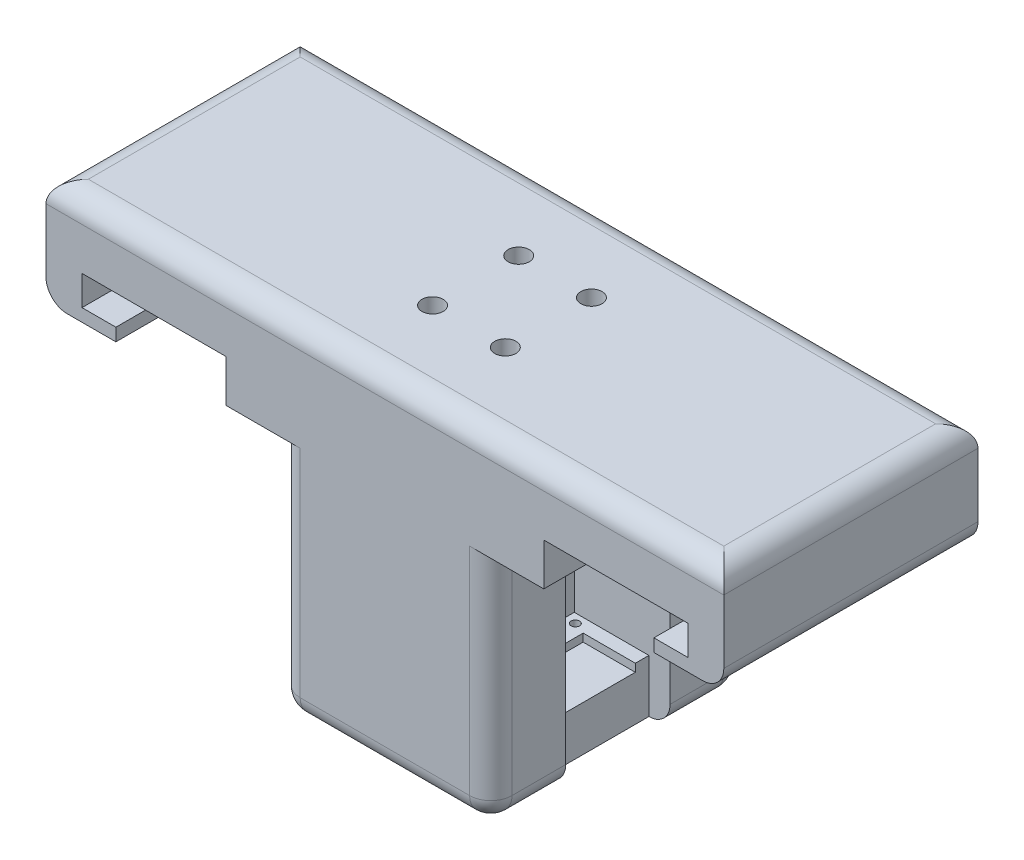
from build123d import *

# Parameters (mm, degrees)
BOSS_EXTRUDE1_DEPTH            = 30
BOSS_EXTRUDE1_DEPTH_BACK       = 30
CUT_REVOLVE2_START             = 59
CUT_REVOLVE2_DEPTH             = 7
CUT_REVOLVE2_START_2           = 56
CUT_REVOLVE2_2_DEPTH           = 3
CUT_EXTRUDE1_DEPTH             = 22.615
CUT_EXTRUDE2_REACH             = 130.69
CUT_EXTRUDE2_DIRECTION_2_DEPTH = 129.689548915
FILLET5_R                      = 5
FILLET6_R                      = 5
SKETCH7_W                      = 18.23
SKETCH7_H                      = 1.85
CUT_EXTRUDE3_DEPTH             = 17.32
SKETCH8_W                      = 20
SKETCH8_H                      = 24.63
CUT_EXTRUDE4_DEPTH             = 15.3
CUT_EXTRUDE5_REACH             = 119.733
SKETCH10_R                     = 1
SKETCH12_R                     = 2.5
CUT_EXTRUDE6_DEPTH             = 10.5
CUT_EXTRUDE7_REACH             = 119.733
SKETCH13_R                     = 1
SKETCH14_R                     = 2.5
CUT_EXTRUDE8_DEPTH             = 34.5


# Read off the part's stored shape, not the designer's step: Cut-Revolve2
with BuildPart() as part:
    # Sketch1 → Boss-Extrude1 (new, two sides: drawn at the far end of the back side and taken through both)
    with BuildSketch(Plane.XY.offset(-BOSS_EXTRUDE1_DEPTH_BACK)):
        Polygon((-25, 0), (-25, 56), (-80, 56), (-80, 81), (80, 81), (80, 56), (25, 56), (25, 0), align=None)
    extrude(amount=BOSS_EXTRUDE1_DEPTH + BOSS_EXTRUDE1_DEPTH_BACK)

    # Cut-Revolve2 outline → Cut-Revolve2 (cut)
    with BuildSketch(Plane(origin=(0, 0, 0), x_dir=(1, 0, 0), z_dir=(0, 1, 0)).offset(CUT_REVOLVE2_START)):
        with BuildLine():
            ThreePointArc((-37.5, -6), (-43.043277195, -2.296100594), (-41.742640687, 4.242640687))
            Line((-41.742640687, 4.242640687), (-61.54163056, 24.04163056))
            ThreePointArc((-61.54163056, 24.04163056), (-71.129711609, -5.004247907), (-53.5, -30))
            Line((-53.5, -30), (-37.5, -30))
            Line((-37.5, -30), (-37.5, -6))
        make_face()
    cut_revolve2 = extrude(amount=CUT_REVOLVE2_DEPTH, mode=Mode.SUBTRACT)

    # Cut-Revolve2 2 outline → Cut-Revolve2 2 (cut)
    with BuildSketch(Plane(origin=(0, 0, 0), x_dir=(1, 0, 0), z_dir=(0, 1, 0)).offset(CUT_REVOLVE2_START_2)):
        with BuildLine():
            Line((-37.5, -26), (-37.5, -14))
            ThreePointArc((-37.5, -14), (-50.434313455, -5.357568053), (-47.399494937, 9.899494937))
            Line((-47.399494937, 9.899494937), (-55.884776311, 18.384776311))
            ThreePointArc((-55.884776311, 18.384776311), (-61.520867845, -9.949769241), (-37.5, -26))
        make_face()
    cut_revolve2_2 = extrude(amount=CUT_REVOLVE2_2_DEPTH, mode=Mode.SUBTRACT)

    # Sketch4 → Cut-Extrude1 (cut)
    with BuildSketch(Plane.ZY.offset(25)):
        Polygon((12.315, 12.5), (-12.315, 12.5), (-12.315, 44.5), (-6.965, 44.5), (-6.965, 45.65), (7.015, 45.65), (7.015, 44.5), (12.315, 44.5), align=None)
    cut_extrude1 = extrude(amount=-CUT_EXTRUDE1_DEPTH, mode=Mode.SUBTRACT)

    # Mirror1: Cut-Extrude1 across plane
    add(cut_extrude1.mirror(Plane.ZY), mode=Mode.SUBTRACT)

    # Sketch5 → Cut-Extrude2 (cut, up to next)
    with BuildSketch(Plane.XY.offset(30), mode=Mode.PRIVATE) as cut_extrude2_sk1:
        Polygon((-63.5, 56), (-37.5, 56), (-37.5, 66), (-71.5, 66), (-71.5, 59), (-63.5, 59), align=None)
    cut_extrude2_tool1 = extrude(cut_extrude2_sk1.sketch, amount=-CUT_EXTRUDE2_REACH, mode=Mode.PRIVATE) & part.part
    cut_extrude2 = cut_extrude2_tool1.solids().sort_by_distance((-53.512658, 61.265823, 30))[0]
    add(cut_extrude2, mode=Mode.SUBTRACT)

    # Sketch5 → Cut-Extrude2 direction 2 (cut)
    with BuildSketch(Plane.XY.offset(30)):
        Polygon((-63.5, 56), (-37.5, 56), (-37.5, 66), (-71.5, 66), (-71.5, 59), (-63.5, 59), align=None)
    cut_extrude2_direction_2 = extrude(amount=CUT_EXTRUDE2_DIRECTION_2_DEPTH, mode=Mode.SUBTRACT)

    # Mirror4: Cut-Revolve2, Cut-Revolve2 2 across plane
    add(cut_revolve2.mirror(Plane.ZY), mode=Mode.SUBTRACT)
    add(cut_revolve2_2.mirror(Plane.ZY), mode=Mode.SUBTRACT)

    # Mirror2: Cut-Extrude2, Cut-Extrude2 direction 2 across plane
    add(cut_extrude2.mirror(Plane.ZY), mode=Mode.SUBTRACT)
    add(cut_extrude2_direction_2.mirror(Plane.ZY), mode=Mode.SUBTRACT)

    # Fillet5
    fillet5_edges = [part.edges().sort_by_distance(p)[0] for p in [
        (-80, 81, 0),
        (80, 81, 0),
        (0, 81, -30),
        (0, 81, 30),
    ]]
    fillet(fillet5_edges, radius=FILLET5_R)

    # Fillet6
    fillet6_edges = [part.edges().sort_by_distance(p)[0] for p in [
        (-25, 0, 0),
        (-80, 56, 0),
        (80, 56, 0),
        (25, 0, 0),
        (0, 0, 30),
        (25, 28, 30),
        (-25, 28, 30),
        (-25, 28, -30),
        (0, 0, -30),
        (25, 28, -30),
    ]]
    fillet(fillet6_edges, radius=FILLET6_R)

    # Sketch7 → Cut-Extrude3 (cut)
    with BuildSketch(Plane.ZY.offset(25)):
        with Locations((0, 11.575)):
            Rectangle(SKETCH7_W, SKETCH7_H)
    cut_extrude3 = extrude(amount=-CUT_EXTRUDE3_DEPTH, mode=Mode.SUBTRACT)

    # Mirror5: Cut-Extrude3 across plane
    add(cut_extrude3.mirror(Plane.ZY), mode=Mode.SUBTRACT)

    # Sketch8 → Cut-Extrude4 (cut)
    with BuildSketch(Plane.XZ):
        with Locations((-30, 0)):
            Rectangle(SKETCH8_W, SKETCH8_H)
        with Locations((30, 0)):
            Rectangle(SKETCH8_W, SKETCH8_H)
    extrude(amount=-CUT_EXTRUDE4_DEPTH, mode=Mode.SUBTRACT)

    # Sketch10 → Cut-Extrude5 (cut, up to next)
    with BuildSketch(Plane(origin=(0, 0, 0), x_dir=(-1, 0, 0), z_dir=(0, -1, 0)), mode=Mode.PRIVATE) as cut_extrude5_sk1:
        with Locations(Location((4.785, -10.165, 0), (0, 0, 90))):
            Circle(SKETCH10_R)
    cut_extrude5_tool1 = extrude(cut_extrude5_sk1.sketch, amount=-CUT_EXTRUDE5_REACH, mode=Mode.PRIVATE) & part.part
    # Sketch10 → Cut-Extrude5 (cut, up to next)
    with BuildSketch(Plane(origin=(0, 0, 0), x_dir=(-1, 0, 0), z_dir=(0, -1, 0)), mode=Mode.PRIVATE) as cut_extrude5_sk2:
        with Locations(Location((4.785, 10.165, 0), (0, 0, 180))):
            Circle(SKETCH10_R)
    cut_extrude5_tool2 = extrude(cut_extrude5_sk2.sketch, amount=-CUT_EXTRUDE5_REACH, mode=Mode.PRIVATE) & part.part
    # Sketch10 → Cut-Extrude5 (cut, up to next)
    with BuildSketch(Plane(origin=(0, 0, 0), x_dir=(-1, 0, 0), z_dir=(0, -1, 0)), mode=Mode.PRIVATE) as cut_extrude5_sk3:
        with Locations(Location((-4.785, 10.165, 0), (0, 0, 90))):
            Circle(SKETCH10_R)
    cut_extrude5_tool3 = extrude(cut_extrude5_sk3.sketch, amount=-CUT_EXTRUDE5_REACH, mode=Mode.PRIVATE) & part.part
    # Sketch10 → Cut-Extrude5 (cut, up to next)
    with BuildSketch(Plane(origin=(0, 0, 0), x_dir=(-1, 0, 0), z_dir=(0, -1, 0)), mode=Mode.PRIVATE) as cut_extrude5_sk4:
        with Locations((-4.785, -10.165)):
            Circle(SKETCH10_R)
    cut_extrude5_tool4 = extrude(cut_extrude5_sk4.sketch, amount=-CUT_EXTRUDE5_REACH, mode=Mode.PRIVATE) & part.part
    add(cut_extrude5_tool1.solids().sort_by_distance((-4.785, 0, 10.165))[0], mode=Mode.SUBTRACT)
    add(cut_extrude5_tool2.solids().sort_by_distance((-4.785, 0, -10.165))[0], mode=Mode.SUBTRACT)
    add(cut_extrude5_tool3.solids().sort_by_distance((4.785, 0, -10.165))[0], mode=Mode.SUBTRACT)
    add(cut_extrude5_tool4.solids().sort_by_distance((4.785, 0, 10.165))[0], mode=Mode.SUBTRACT)

    # Sketch12 → Cut-Extrude6 (cut)
    with BuildSketch(Plane.XZ):
        with Locations(Location((-4.785, 10.165, 0), (0, 0, 270))):
            Circle(SKETCH12_R)
        with Locations((-4.785, -10.165)):
            Circle(SKETCH12_R)
        with Locations(Location((4.785, -10.165, 0), (0, 0, 270))):
            Circle(SKETCH12_R)
        with Locations((4.785, 10.165)):
            Circle(SKETCH12_R)
    extrude(amount=-CUT_EXTRUDE6_DEPTH, mode=Mode.SUBTRACT)

    # Sketch13 → Cut-Extrude7 (cut, up to next)
    with BuildSketch(Plane(origin=(0, 81, 0), x_dir=(1, 0, 0), z_dir=(0, 1, 0)), mode=Mode.PRIVATE) as cut_extrude7_sk1:
        with Locations(Location((-8.585, 10.165, 0), (0, 0, 270))):
            Circle(SKETCH13_R)
    cut_extrude7_tool1 = extrude(cut_extrude7_sk1.sketch, amount=-CUT_EXTRUDE7_REACH, mode=Mode.PRIVATE) & part.part
    # Sketch13 → Cut-Extrude7 (cut, up to next)
    with BuildSketch(Plane(origin=(0, 81, 0), x_dir=(1, 0, 0), z_dir=(0, 1, 0)), mode=Mode.PRIVATE) as cut_extrude7_sk2:
        with Locations(Location((-8.585, -10.165, 0), (0, 0, 180))):
            Circle(SKETCH13_R)
    cut_extrude7_tool2 = extrude(cut_extrude7_sk2.sketch, amount=-CUT_EXTRUDE7_REACH, mode=Mode.PRIVATE) & part.part
    # Sketch13 → Cut-Extrude7 (cut, up to next)
    with BuildSketch(Plane(origin=(0, 81, 0), x_dir=(1, 0, 0), z_dir=(0, 1, 0)), mode=Mode.PRIVATE) as cut_extrude7_sk3:
        with Locations(Location((8.585, -10.165, 0), (0, 0, 270))):
            Circle(SKETCH13_R)
    cut_extrude7_tool3 = extrude(cut_extrude7_sk3.sketch, amount=-CUT_EXTRUDE7_REACH, mode=Mode.PRIVATE) & part.part
    # Sketch13 → Cut-Extrude7 (cut, up to next)
    with BuildSketch(Plane(origin=(0, 81, 0), x_dir=(1, 0, 0), z_dir=(0, 1, 0)), mode=Mode.PRIVATE) as cut_extrude7_sk4:
        with Locations((8.585, 10.165)):
            Circle(SKETCH13_R)
    cut_extrude7_tool4 = extrude(cut_extrude7_sk4.sketch, amount=-CUT_EXTRUDE7_REACH, mode=Mode.PRIVATE) & part.part
    add(cut_extrude7_tool1.solids().sort_by_distance((-8.585, 81, -10.165))[0], mode=Mode.SUBTRACT)
    add(cut_extrude7_tool2.solids().sort_by_distance((-8.585, 81, 10.165))[0], mode=Mode.SUBTRACT)
    add(cut_extrude7_tool3.solids().sort_by_distance((8.585, 81, 10.165))[0], mode=Mode.SUBTRACT)
    add(cut_extrude7_tool4.solids().sort_by_distance((8.585, 81, -10.165))[0], mode=Mode.SUBTRACT)

    # Sketch14 → Cut-Extrude8 (cut)
    with BuildSketch(Plane(origin=(0, 81, 0), x_dir=(1, 0, 0), z_dir=(0, 1, 0))):
        with Locations(Location((-8.585, 10.165, 0), (0, 0, 270))):
            Circle(SKETCH14_R)
        with Locations(Location((-8.585, -10.165, 0), (0, 0, 180))):
            Circle(SKETCH14_R)
        with Locations(Location((8.585, -10.165, 0), (0, 0, 270))):
            Circle(SKETCH14_R)
        with Locations(Location((8.585, 10.165, 0), (0, 0, 180))):
            Circle(SKETCH14_R)
    extrude(amount=-CUT_EXTRUDE8_DEPTH, mode=Mode.SUBTRACT)


solid = part.part
